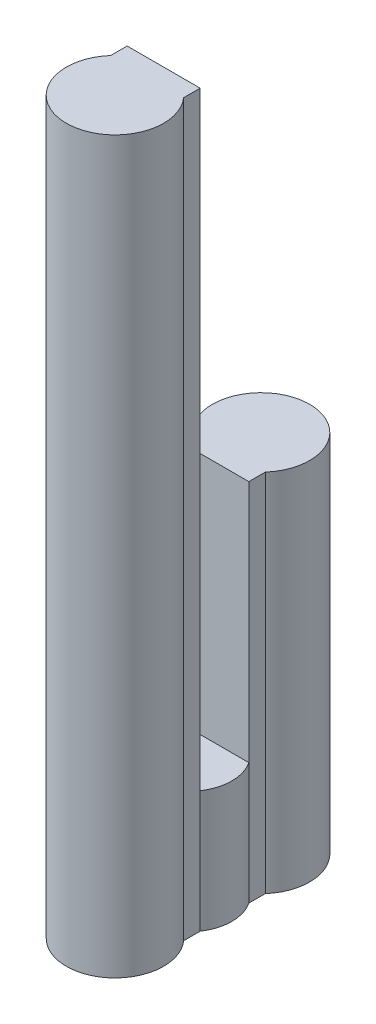
from build123d import *

# Parameters (mm, degrees)
EXTRUDE_1_DEPTH = 15
EXTRUDE_2_DEPTH = 30
SKETCH_3_R      = 1.802775638
EXTRUDE_3_DEPTH = 5


with BuildPart() as part:
    # 草图1 → 凸台-拉伸1 (new body)
    with BuildSketch(Plane(origin=(0, 0, 0), x_dir=(1, 0, 0), z_dir=(0, 1, 0))):
        with BuildLine():
            Line((-1.5, 0), (1.5, 0))
            Line((1.5, 0), (1.5, 0.677124344))
            ThreePointArc((1.5, 0.677124344), (0, 4), (-1.5, 0.677124344))
            Line((-1.5, 0.677124344), (-1.5, 0))
        make_face()
    extrude(amount=EXTRUDE_1_DEPTH)



with BuildPart() as body_2:
    # 草图2 → 凸台-拉伸2 (new body)
    with BuildSketch(Plane.XZ):
        with BuildLine():
            Line((1.5, 2), (-1.5, 2))
            Line((-1.5, 2), (-1.5, 2.677124344))
            ThreePointArc((-1.5, 2.677124344), (0, 6), (1.5, 2.677124344))
            Line((1.5, 2.677124344), (1.5, 2))
        make_face()
    extrude(amount=-EXTRUDE_2_DEPTH)


with BuildPart() as part_1:
    add(part.part)

    add(body_2.part)  # 凸台-拉伸3 merges body 2
    # 草图3 → 凸台-拉伸3 (add)
    with BuildSketch(Plane.XZ):
        with Locations((0, 1)):
            Circle(SKETCH_3_R)
    extrude(amount=-EXTRUDE_3_DEPTH)


solid = part_1.part
